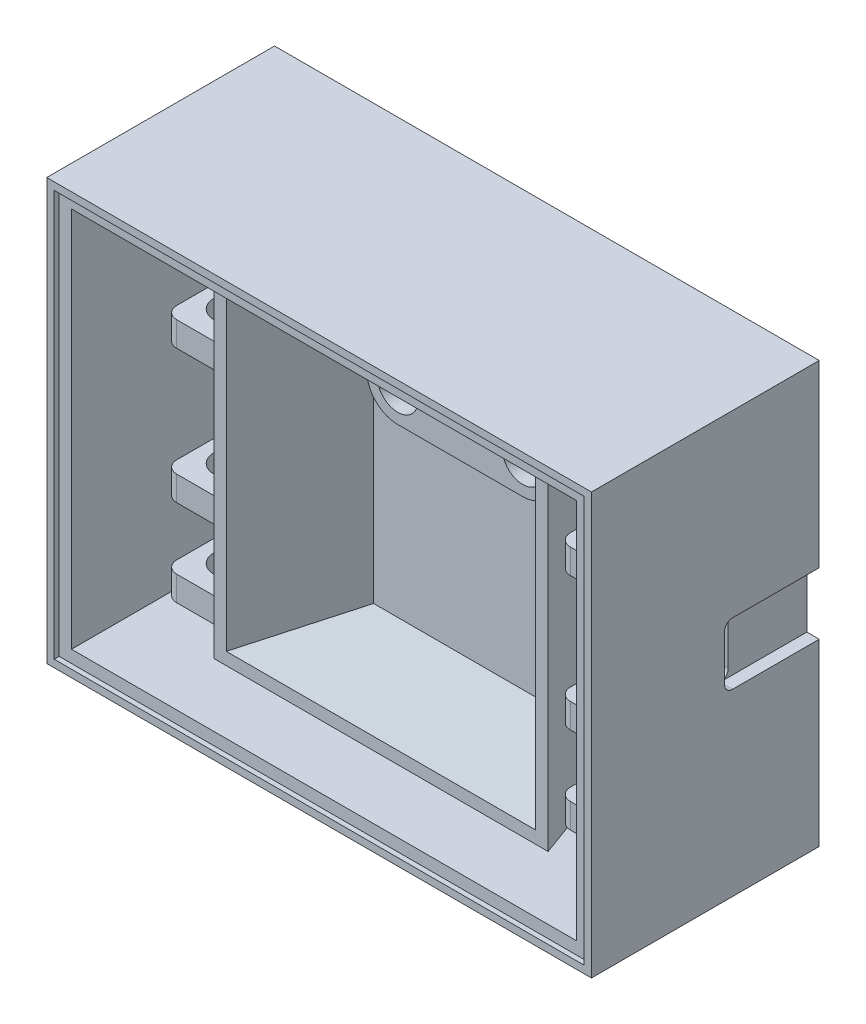
from build123d import *

# Parameters (mm, degrees)
SKETCH1_W              = 44
SKETCH1_H              = 34
SKETCH1_R              = 2
BOSS_EXTRUDE1_DEPTH    = 4.5
SKETCH2_W              = 44
SKETCH2_H              = 34
SKETCH2_W_2            = 40.8
SKETCH2_H_2            = 30.8
BOSS_EXTRUDE2_DEPTH    = 13.5
SKETCH3_R              = 1.65
BOSS_EXTRUDE3_DEPTH    = 2.5
CUT_EXTRUDE1_START     = -6
SKETCH4_R              = 1.65
CUT_EXTRUDE1_DEPTH     = 6
CUT_EXTRUDE2_DEPTH     = 4
CUT_EXTRUDE3_DEPTH     = 3
SKETCH7_W              = 7
SKETCH7_H              = 5
CUT_EXTRUDE4_DEPTH     = 1
SKETCH8_W              = 44
SKETCH8_H              = 34
SKETCH8_W_2            = 42.8
SKETCH8_H_2            = 32.8
BOSS_EXTRUDE4_DEPTH    = 0.4
SKETCH9_R              = 1.65
BOSS_EXTRUDE5_DEPTH    = 0.2
SKETCH10_W             = 5
SKETCH10_H             = 2
BOSS_EXTRUDE6_DEPTH    = 8
SKETCH11_R             = 1.5
CUT_EXTRUDE5_DEPTH     = 3
FILLET1_R              = 1
LPATTERN1_COUNT        = 2
LPATTERN1_PITCH        = 7
FILLET1_OF_LPATTERN1_R = 1
LPATTERN2_COUNT        = 2
LPATTERN2_PITCH        = 10.5
FILLET1_OF_LPATTERN2_R = 1
MIRROR1_START          = 10.4
MIRROR1_OUTLINE_R      = 1.5
MIRROR1_DEPTH          = 4
MIRROR1_START_2        = 3.4
MIRROR1_2_OUTLINE_R    = 1.5
MIRROR1_2_DEPTH        = 4
MIRROR1_START_3        = 7.888352481
MIRROR1_3_DEPTH        = 11.511647519
MIRROR1_START_4        = 1.9
MIRROR1_4_DEPTH        = 6
MIRROR2_START          = -19.4
MIRROR2_DEPTH          = 7
MIRROR2_START_2        = 12.4
MIRROR2_2_DEPTH        = 7
MIRROR2_START_3        = -8.9
MIRROR2_3_DEPTH        = 7
MIRROR2_START_4        = 1.9
MIRROR2_4_DEPTH        = 7
MIRROR2_START_5        = -14.4
MIRROR2_5_OUTLINE_R    = 1.5
MIRROR2_5_DEPTH        = 11
CUT_EXTRUDE6_START     = -1
SKETCH12_W             = 17.8
SKETCH12_H             = 12.342047318
CUT_EXTRUDE6_DEPTH     = 3
SKETCH14_W             = 17.8
SKETCH14_H             = 2
CUT_EXTRUDE8_DEPTH     = 8
SKETCH17_R             = 1.65
BOSS_EXTRUDE7_DEPTH    = 2.5


with BuildPart() as part:
    # Sketch1 → Boss-Extrude1 (new body)
    with BuildSketch(Plane.XY):
        Rectangle(SKETCH1_W, SKETCH1_H)
        with Locations((-18.5, 0)):
            Circle(SKETCH1_R, mode=Mode.SUBTRACT)
        with Locations((18.5, 0)):
            Circle(SKETCH1_R, mode=Mode.SUBTRACT)
    extrude(amount=BOSS_EXTRUDE1_DEPTH)

    # Sketch2 → Boss-Extrude2 (add)
    with BuildSketch(Plane.XY.offset(4.5)):
        Rectangle(SKETCH2_W, SKETCH2_H)
        Rectangle(SKETCH2_W_2, SKETCH2_H_2, mode=Mode.SUBTRACT)
    extrude(amount=BOSS_EXTRUDE2_DEPTH)

    # Sketch3 → Boss-Extrude3 (add)
    with BuildSketch(Plane.XY.offset(4.5)):
        with BuildLine():
            Line((-5.05, 7.5), (5.05, 7.5))
            ThreePointArc((5.05, 7.5), (7.55, 5), (5.05, 2.5))
            Line((5.05, 2.5), (-5.05, 2.5))
            ThreePointArc((-5.05, 2.5), (-7.55, 5), (-5.05, 7.5))
        make_face()
        with Locations((-5.05, 5)):
            Circle(SKETCH3_R, mode=Mode.SUBTRACT)
        with Locations((5.05, 5)):
            Circle(SKETCH3_R, mode=Mode.SUBTRACT)
    extrude(amount=BOSS_EXTRUDE3_DEPTH)

    # Sketch4 → Cut-Extrude1 (cut)
    with BuildSketch(Plane.XY.offset(4.5).offset(CUT_EXTRUDE1_START)):
        with Locations((-5.05, 5)):
            Circle(SKETCH4_R)
        with Locations((5.05, 5)):
            Circle(SKETCH4_R)
    extrude(amount=CUT_EXTRUDE1_DEPTH, mode=Mode.SUBTRACT)

    # Sketch5 → Cut-Extrude2 (cut)
    with BuildSketch(Plane(origin=(0, 0, 0), x_dir=(-1, 0, 0), z_dir=(0, 0, -1))):
        Polygon((-5.05, 1.766838493), (-2.25, 3.383419246), (-2.25, 6.616580754), (-5.05, 8.233161507), (-7.85, 6.616580754), (-7.85, 3.383419246), align=None)
        Polygon((5.05, 1.766838493), (7.85, 3.383419246), (7.85, 6.616580754), (5.05, 8.233161507), (2.25, 6.616580754), (2.25, 3.383419246), align=None)
    extrude(amount=-CUT_EXTRUDE2_DEPTH, mode=Mode.SUBTRACT)

    # Sketch6 → Cut-Extrude3 (cut)
    with BuildSketch(Plane(origin=(22, 0, 0), x_dir=(0, 0, -1), z_dir=(1, 0, 0))):
        with BuildLine():
            Line((-6.35, 1.85), (-6.35, -1.85))
            ThreePointArc((-6.35, -1.85), (-7, -2.5), (-7.65, -1.85))
            Line((-7.65, -1.85), (-7.65, 1.85))
            ThreePointArc((-7.65, 1.85), (-7, 2.5), (-6.35, 1.85))
        make_face()
    extrude(amount=-CUT_EXTRUDE3_DEPTH, mode=Mode.SUBTRACT)

    # Sketch7 → Cut-Extrude4 (cut)
    with BuildSketch(Plane(origin=(22, 0, 0), x_dir=(0, 0, -1), z_dir=(1, 0, 0))):
        with Locations((-3.5, 0)):
            Rectangle(SKETCH7_W, SKETCH7_H)
    extrude(amount=-CUT_EXTRUDE4_DEPTH, mode=Mode.SUBTRACT)

    # Sketch8 → Boss-Extrude4 (add)
    with BuildSketch(Plane.XY.offset(18)):
        Rectangle(SKETCH8_W, SKETCH8_H)
        Rectangle(SKETCH8_W_2, SKETCH8_H_2, mode=Mode.SUBTRACT)
    extrude(amount=BOSS_EXTRUDE4_DEPTH)

    # Sketch9 → Boss-Extrude5 (add)
    with BuildSketch(Plane(origin=(0, 0, 4), x_dir=(-1, 0, 0), z_dir=(0, 0, -1))):
        with Locations((-5.05, 5)):
            Circle(SKETCH9_R)
        with Locations((5.05, 5)):
            Circle(SKETCH9_R)
    extrude(amount=-BOSS_EXTRUDE5_DEPTH)

    # Sketch10 → Boss-Extrude6 (add)
    with BuildSketch(Plane.XY.offset(4.5)):
        with Locations((-15.9, 12.4)):
            Rectangle(SKETCH10_W, SKETCH10_H)
    boss_extrude6 = extrude(amount=BOSS_EXTRUDE6_DEPTH)

    # Sketch11 → Cut-Extrude5 (cut)
    with BuildSketch(Plane.XZ.offset(-11.4)):
        with Locations(Location((-15.9, 9.5, 0), (0, 0, 270))):
            Circle(SKETCH11_R)
    cut_extrude5 = extrude(amount=-CUT_EXTRUDE5_DEPTH, mode=Mode.SUBTRACT)

    # Fillet1
    fillet1_edges = [part.edges().sort_by_distance(p)[0] for p in [
        (-18.4, 12.4, 4.5),
        (-15.9, 11.4, 4.5),
        (-13.4, 12.4, 4.5),
        (-15.9, 13.4, 4.5),
        (-18.4, 12.4, 12.5),
        (-13.4, 12.4, 12.5),
    ]]
    fillet(fillet1_edges, radius=FILLET1_R)

    # LPattern1: Boss-Extrude6, Cut-Extrude5 ×2
    with Locations(*[(0, -i * LPATTERN1_PITCH, 0) for i in range(1, LPATTERN1_COUNT)]):
        add(boss_extrude6)
        add(cut_extrude5, mode=Mode.SUBTRACT)

    # Fillet1 of LPattern1
    fillet1_of_lpattern1_edges = [part.edges().sort_by_distance(p)[0] for p in [
        (-18.4, 5.4, 4.5),
        (-15.9, 4.4, 4.5),
        (-13.4, 5.4, 4.5),
        (-15.9, 6.4, 4.5),
        (-18.4, 5.4, 12.5),
        (-13.4, 5.4, 12.5),
    ]]
    fillet(fillet1_of_lpattern1_edges, radius=FILLET1_OF_LPATTERN1_R)

    # LPattern2: Boss-Extrude6, Cut-Extrude5 ×2
    with Locations(*[(i * LPATTERN2_PITCH, 0, 0) for i in range(1, LPATTERN2_COUNT)]):
        add(boss_extrude6)
        add(cut_extrude5, mode=Mode.SUBTRACT)

    # Fillet1 of LPattern2
    fillet1_of_lpattern2_edges = [part.edges().sort_by_distance(p)[0] for p in [
        (-7.9, 12.4, 4.5),
        (-5.4, 11.4, 4.5),
        (-2.9, 12.4, 4.5),
        (-5.4, 13.4, 4.5),
        (-7.9, 12.4, 12.5),
        (-2.9, 12.4, 12.5),
    ]]
    fillet(fillet1_of_lpattern2_edges, radius=FILLET1_OF_LPATTERN2_R)

    # Mirror1: read off the stored shape, not the designer's step
    # Mirror1 outline → Mirror1 (add)
    # profile 1 of 2: a face of its own
    with BuildSketch(Plane(origin=(0, 0, 0), x_dir=(1, 0, 0), z_dir=(0, 1, 0)).offset(MIRROR1_START)):
        with BuildLine():
            ThreePointArc((13.4, -11.5), (13.692893219, -12.207106781), (14.4, -12.5))
            Line((14.4, -12.5), (17.4, -12.5))
            ThreePointArc((17.4, -12.5), (18.107106781, -12.207106781), (18.4, -11.5))
            Line((18.4, -11.5), (18.4, -5.5))
            ThreePointArc((18.4, -5.5), (18.692893219, -4.792893219), (19.4, -4.5))
            Line((19.4, -4.5), (12.4, -4.5))
            ThreePointArc((12.4, -4.5), (13.107106781, -4.792893219), (13.4, -5.5))
            Line((13.4, -5.5), (13.4, -11.5))
        make_face()
        with Locations((15.9, -9.5)):
            Circle(MIRROR1_OUTLINE_R, mode=Mode.SUBTRACT)
    # profile 2 of 2: a face of its own
    with BuildSketch(Plane(origin=(0, 0, 0), x_dir=(1, 0, 0), z_dir=(0, 1, 0)).offset(MIRROR1_START)):
        with BuildLine():
            ThreePointArc((7.9, -5.5), (8.192893219, -4.792893219), (8.9, -4.5))
            Line((8.9, -4.5), (1.9, -4.5))
            ThreePointArc((1.9, -4.5), (2.607106781, -4.792893219), (2.9, -5.5))
            Line((2.9, -5.5), (2.9, -11.5))
            ThreePointArc((2.9, -11.5), (3.192893219, -12.207106781), (3.9, -12.5))
            Line((3.9, -12.5), (6.9, -12.5))
            ThreePointArc((6.9, -12.5), (7.607106781, -12.207106781), (7.9, -11.5))
            Line((7.9, -11.5), (7.9, -5.5))
        make_face()
        with Locations((5.4, -9.5)):
            Circle(MIRROR1_OUTLINE_R, mode=Mode.SUBTRACT)
    extrude(amount=MIRROR1_DEPTH)

    # Mirror1 2 outline → Mirror1 2 (add)
    with BuildSketch(Plane(origin=(0, 0, 0), x_dir=(1, 0, 0), z_dir=(0, 1, 0)).offset(MIRROR1_START_2)):
        with BuildLine():
            ThreePointArc((13.4, -11.5), (13.692893219, -12.207106781), (14.4, -12.5))
            Line((14.4, -12.5), (17.4, -12.5))
            ThreePointArc((17.4, -12.5), (18.107106781, -12.207106781), (18.4, -11.5))
            Line((18.4, -11.5), (18.4, -5.5))
            ThreePointArc((18.4, -5.5), (18.692893219, -4.792893219), (19.4, -4.5))
            Line((19.4, -4.5), (12.4, -4.5))
            ThreePointArc((12.4, -4.5), (13.107106781, -4.792893219), (13.4, -5.5))
            Line((13.4, -5.5), (13.4, -11.5))
        make_face()
        with Locations((15.9, -9.5)):
            Circle(MIRROR1_2_OUTLINE_R, mode=Mode.SUBTRACT)
    extrude(amount=MIRROR1_2_DEPTH)

    # Mirror1 3 outline → Mirror1 3 (cut)
    with BuildSketch(Plane.YZ.offset(MIRROR1_START_3)):
        with BuildLine():
            Line((11.4, 5.5), (11.4, 12.5))
            Line((11.4, 12.5), (10.4, 12.5))
            Line((10.4, 12.5), (10.4, 4.5))
            ThreePointArc((10.4, 4.5), (11.107106781, 4.792893219), (11.4, 5.5))
        make_face()
        with BuildLine():
            Line((14.4, 12.5), (13.4, 12.5))
            Line((13.4, 12.5), (13.4, 5.5))
            ThreePointArc((13.4, 5.5), (13.692893219, 4.792893219), (14.4, 4.5))
            Line((14.4, 4.5), (14.4, 12.5))
        make_face()
        with BuildLine():
            Line((4.4, 5.5), (4.4, 12.5))
            Line((4.4, 12.5), (3.4, 12.5))
            Line((3.4, 12.5), (3.4, 4.5))
            ThreePointArc((3.4, 4.5), (4.107106781, 4.792893219), (4.4, 5.5))
        make_face()
        with BuildLine():
            Line((7.4, 12.5), (6.4, 12.5))
            Line((6.4, 12.5), (6.4, 5.5))
            ThreePointArc((6.4, 5.5), (6.692893219, 4.792893219), (7.4, 4.5))
            Line((7.4, 4.5), (7.4, 12.5))
        make_face()
    extrude(amount=MIRROR1_3_DEPTH, mode=Mode.SUBTRACT)

    # Mirror1 4 outline → Mirror1 4 (cut)
    with BuildSketch(Plane.YZ.offset(MIRROR1_START_4)):
        with BuildLine():
            Line((11.4, 5.5), (11.4, 12.5))
            Line((11.4, 12.5), (10.4, 12.5))
            Line((10.4, 12.5), (10.4, 4.5))
            ThreePointArc((10.4, 4.5), (11.107106781, 4.792893219), (11.4, 5.5))
        make_face()
        with BuildLine():
            Line((14.4, 12.5), (13.4, 12.5))
            Line((13.4, 12.5), (13.4, 5.5))
            ThreePointArc((13.4, 5.5), (13.692893219, 4.792893219), (14.4, 4.5))
            Line((14.4, 4.5), (14.4, 12.5))
        make_face()
    extrude(amount=MIRROR1_4_DEPTH, mode=Mode.SUBTRACT)

    # Mirror2: read off the stored shape, not the designer's step
    # Mirror2 outline → Mirror2 (add)
    with BuildSketch(Plane.YZ.offset(MIRROR2_START)):
        with BuildLine():
            Line((-11.4, 5.5), (-11.4, 12.5))
            Line((-11.4, 12.5), (-13.4, 12.5))
            Line((-13.4, 12.5), (-13.4, 5.5))
            ThreePointArc((-13.4, 5.5), (-13.692893219, 4.792893219), (-14.4, 4.5))
            Line((-14.4, 4.5), (-10.4, 4.5))
            ThreePointArc((-10.4, 4.5), (-11.107106781, 4.792893219), (-11.4, 5.5))
        make_face()
        with BuildLine():
            ThreePointArc((-6.4, 5.5), (-6.692893219, 4.792893219), (-7.4, 4.5))
            Line((-7.4, 4.5), (-3.4, 4.5))
            ThreePointArc((-3.4, 4.5), (-4.107106781, 4.792893219), (-4.4, 5.5))
            Line((-4.4, 5.5), (-4.4, 12.5))
            Line((-4.4, 12.5), (-6.4, 12.5))
            Line((-6.4, 12.5), (-6.4, 5.5))
        make_face()
    extrude(amount=MIRROR2_DEPTH)

    # Mirror2 2 outline → Mirror2 2 (add)
    with BuildSketch(Plane.YZ.offset(MIRROR2_START_2)):
        with BuildLine():
            Line((-11.4, 5.5), (-11.4, 12.5))
            Line((-11.4, 12.5), (-13.4, 12.5))
            Line((-13.4, 12.5), (-13.4, 5.5))
            ThreePointArc((-13.4, 5.5), (-13.692893219, 4.792893219), (-14.4, 4.5))
            Line((-14.4, 4.5), (-10.4, 4.5))
            ThreePointArc((-10.4, 4.5), (-11.107106781, 4.792893219), (-11.4, 5.5))
        make_face()
        with BuildLine():
            ThreePointArc((-6.4, 5.5), (-6.692893219, 4.792893219), (-7.4, 4.5))
            Line((-7.4, 4.5), (-3.4, 4.5))
            ThreePointArc((-3.4, 4.5), (-4.107106781, 4.792893219), (-4.4, 5.5))
            Line((-4.4, 5.5), (-4.4, 12.5))
            Line((-4.4, 12.5), (-6.4, 12.5))
            Line((-6.4, 12.5), (-6.4, 5.5))
        make_face()
    extrude(amount=MIRROR2_2_DEPTH)

    # Mirror2 3 outline → Mirror2 3 (add)
    with BuildSketch(Plane.YZ.offset(MIRROR2_START_3)):
        with BuildLine():
            Line((-11.4, 5.5), (-11.4, 12.5))
            Line((-11.4, 12.5), (-13.4, 12.5))
            Line((-13.4, 12.5), (-13.4, 5.5))
            ThreePointArc((-13.4, 5.5), (-13.692893219, 4.792893219), (-14.4, 4.5))
            Line((-14.4, 4.5), (-10.4, 4.5))
            ThreePointArc((-10.4, 4.5), (-11.107106781, 4.792893219), (-11.4, 5.5))
        make_face()
    extrude(amount=MIRROR2_3_DEPTH)

    # Mirror2 4 outline → Mirror2 4 (add)
    with BuildSketch(Plane.YZ.offset(MIRROR2_START_4)):
        with BuildLine():
            Line((-11.4, 5.5), (-11.4, 12.5))
            Line((-11.4, 12.5), (-13.4, 12.5))
            Line((-13.4, 12.5), (-13.4, 5.5))
            ThreePointArc((-13.4, 5.5), (-13.692893219, 4.792893219), (-14.4, 4.5))
            Line((-14.4, 4.5), (-10.4, 4.5))
            ThreePointArc((-10.4, 4.5), (-11.107106781, 4.792893219), (-11.4, 5.5))
        make_face()
    extrude(amount=MIRROR2_4_DEPTH)

    # Mirror2 5 outline → Mirror2 5 (cut)
    with BuildSketch(Plane(origin=(0, 0, 0), x_dir=(1, 0, 0), z_dir=(0, 1, 0)).offset(MIRROR2_START_5)):
        with BuildLine():
            ThreePointArc((-13.4, -11.5), (-13.692893219, -12.207106781), (-14.4, -12.5))
            Line((-14.4, -12.5), (-12.4, -12.5))
            Line((-12.4, -12.5), (-12.4, -4.5))
            ThreePointArc((-12.4, -4.5), (-13.107106781, -4.792893219), (-13.4, -5.5))
            Line((-13.4, -5.5), (-13.4, -11.5))
        make_face()
        with BuildLine():
            Line((-18.4, -11.5), (-18.4, -5.5))
            ThreePointArc((-18.4, -5.5), (-18.692893219, -4.792893219), (-19.4, -4.5))
            Line((-19.4, -4.5), (-19.4, -12.5))
            Line((-19.4, -12.5), (-17.4, -12.5))
            ThreePointArc((-17.4, -12.5), (-18.107106781, -12.207106781), (-18.4, -11.5))
        make_face()
        with Locations((-15.9, -9.5)):
            Circle(MIRROR2_5_OUTLINE_R)
        with BuildLine():
            ThreePointArc((-2.9, -11.5), (-3.192893219, -12.207106781), (-3.9, -12.5))
            Line((-3.9, -12.5), (-1.9, -12.5))
            Line((-1.9, -12.5), (-1.9, -4.5))
            ThreePointArc((-1.9, -4.5), (-2.607106781, -4.792893219), (-2.9, -5.5))
            Line((-2.9, -5.5), (-2.9, -11.5))
        make_face()
        with BuildLine():
            Line((-7.9, -11.5), (-7.9, -5.5))
            ThreePointArc((-7.9, -5.5), (-8.192893219, -4.792893219), (-8.9, -4.5))
            Line((-8.9, -4.5), (-8.9, -12.5))
            Line((-8.9, -12.5), (-6.9, -12.5))
            ThreePointArc((-6.9, -12.5), (-7.607106781, -12.207106781), (-7.9, -11.5))
        make_face()
        with Locations((-5.4, -9.5)):
            Circle(MIRROR2_5_OUTLINE_R)
        with BuildLine():
            ThreePointArc((19.4, -4.5), (18.692893219, -4.792893219), (18.4, -5.5))
            Line((18.4, -5.5), (18.4, -11.5))
            ThreePointArc((18.4, -11.5), (18.107106781, -12.207106781), (17.4, -12.5))
            Line((17.4, -12.5), (19.4, -12.5))
            Line((19.4, -12.5), (19.4, -4.5))
        make_face()
        with BuildLine():
            Line((12.4, -12.5), (14.4, -12.5))
            ThreePointArc((14.4, -12.5), (13.692893219, -12.207106781), (13.4, -11.5))
            Line((13.4, -11.5), (13.4, -5.5))
            ThreePointArc((13.4, -5.5), (13.107106781, -4.792893219), (12.4, -4.5))
            Line((12.4, -4.5), (12.4, -12.5))
        make_face()
        with Locations((15.9, -9.5)):
            Circle(MIRROR2_5_OUTLINE_R)
        with BuildLine():
            ThreePointArc((8.9, -4.5), (8.192893219, -4.792893219), (7.9, -5.5))
            Line((7.9, -5.5), (7.9, -11.5))
            ThreePointArc((7.9, -11.5), (7.607106781, -12.207106781), (6.9, -12.5))
            Line((6.9, -12.5), (8.9, -12.5))
            Line((8.9, -12.5), (8.9, -4.5))
        make_face()
        with BuildLine():
            Line((1.9, -12.5), (3.9, -12.5))
            ThreePointArc((3.9, -12.5), (3.192893219, -12.207106781), (2.9, -11.5))
            Line((2.9, -11.5), (2.9, -5.5))
            ThreePointArc((2.9, -5.5), (2.607106781, -4.792893219), (1.9, -4.5))
            Line((1.9, -4.5), (1.9, -12.5))
        make_face()
        with Locations((5.4, -9.5)):
            Circle(MIRROR2_5_OUTLINE_R)
    extrude(amount=MIRROR2_5_DEPTH, mode=Mode.SUBTRACT)

    # Sketch12 → Cut-Extrude6 (cut)
    with BuildSketch(Plane.XZ.offset(-11.4).offset(CUT_EXTRUDE6_START)):
        with Locations((0, 10.671023659)):
            Rectangle(SKETCH12_W, SKETCH12_H)
    cut_extrude6 = extrude(amount=CUT_EXTRUDE6_DEPTH, mode=Mode.SUBTRACT)

    # Mirror3: Cut-Extrude6 across plane
    add(cut_extrude6.mirror(Plane.ZX), mode=Mode.SUBTRACT)

    # Sketch14 → Cut-Extrude8 (cut)
    with BuildSketch(Plane.XY.offset(12.5)):
        with Locations((0, 13.4)):
            Rectangle(SKETCH14_W, SKETCH14_H)
        with Locations((0, -13.4)):
            Rectangle(SKETCH14_W, SKETCH14_H)
    extrude(amount=-CUT_EXTRUDE8_DEPTH, mode=Mode.SUBTRACT)

    # Sketch16 → Loft3 section 0
    with BuildSketch(Plane.XY.offset(13.4)):
        with BuildLine():
            Line((-13.5, 14.9), (13.5, 14.9))
            Line((13.5, 14.9), (13.5, -14.9))
            Line((13.5, -14.9), (-13.5, -14.9))
            Line((-13.5, -14.9), (-13.5, 14.9))
        make_face()
    # Sketch15 → Loft3 section 1
    with BuildSketch(Plane.XY.offset(4.5)):
        with BuildLine():
            Line((-10.5, 10.5), (10.5, 10.5))
            Line((10.5, 10.5), (10.5, -14.5))
            Line((10.5, -14.5), (-10.5, -14.5))
            Line((-10.5, -14.5), (-10.5, 10.5))
        make_face()
    loft()

    # Cut-Loft3: read off the stored shape, not the designer's step
    # Cut-Loft3: loft between two sections, ruled curve by curve
    cut_loft3_from = [
        Edge.make_line((9.5, 9.5, 4.5), (-9.5, 9.5, 4.5)),
        Edge.make_line((-9.5, 9.5, 4.5), (-9.5, -13.5, 4.5)),
        Edge.make_line((9.5, -13.5, 4.5), (9.5, 9.5, 4.5)),
        Edge.make_line((-9.5, -13.5, 4.5), (9.5, -13.5, 4.5)),
    ]
    cut_loft3_to = [
        Edge.make_line((12.5, 13.9, 13.4), (-12.5, 13.9, 13.4)),
        Edge.make_line((-12.5, 13.9, 13.4), (-12.5, -13.9, 13.4)),
        Edge.make_line((12.5, -13.9, 13.4), (12.5, 13.9, 13.4)),
        Edge.make_line((-12.5, -13.9, 13.4), (12.5, -13.9, 13.4)),
    ]
    cut_loft3 = Solid(Shell([*[Face.make_surface_from_curves(cut_loft3_from[k], cut_loft3_to[k]) for k in range(4)], Face(Wire(cut_loft3_from)), Face(Wire(cut_loft3_to))]))
    add(cut_loft3, mode=Mode.SUBTRACT)

    # Sketch17 → Boss-Extrude7 (add)
    with BuildSketch(Plane.XY.offset(4.5)):
        with BuildLine():
            Line((-5.05, 7.5), (5.05, 7.5))
            ThreePointArc((5.05, 7.5), (7.55, 5), (5.05, 2.5))
            Line((5.05, 2.5), (-5.05, 2.5))
            ThreePointArc((-5.05, 2.5), (-7.55, 5), (-5.05, 7.5))
        make_face()
        with Locations(Location((5.05, 5, 0), (0, 0, 180))):
            Circle(SKETCH17_R, mode=Mode.SUBTRACT)
        with Locations(Location((-5.05, 5, 0), (0, 0, 180))):
            Circle(SKETCH17_R, mode=Mode.SUBTRACT)
    extrude(amount=BOSS_EXTRUDE7_DEPTH)


solid = part.part
